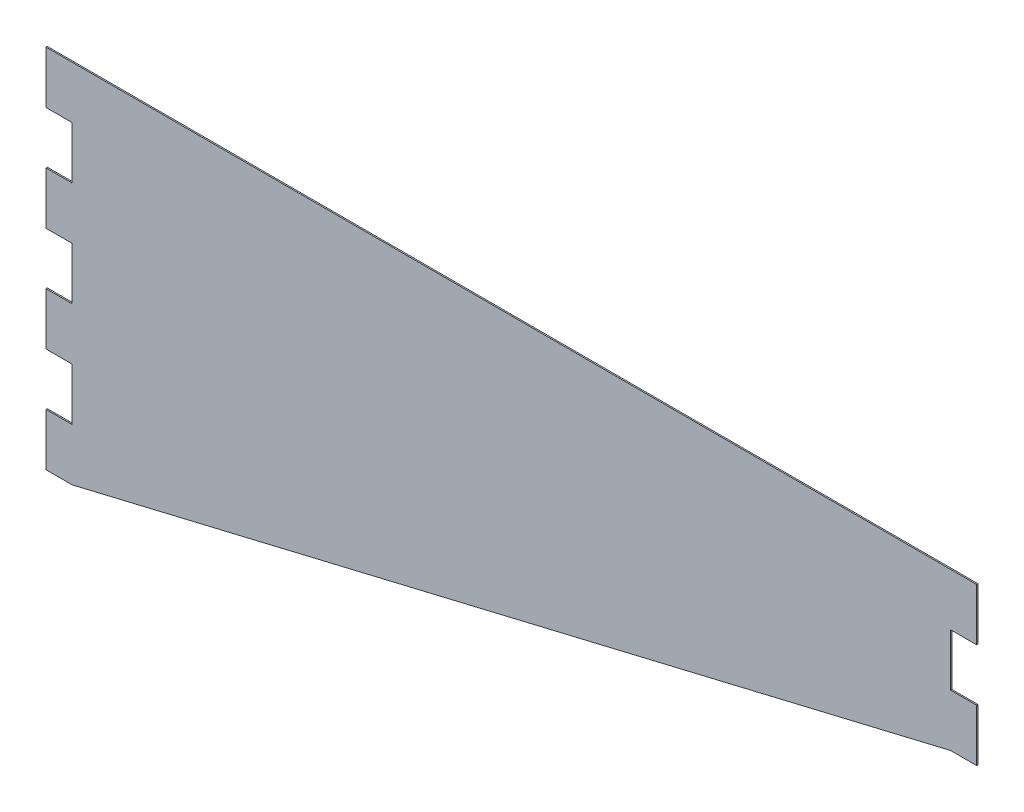
from build123d import *

# Parameters (mm, degrees)
BOSS_EXTRUDE1_DEPTH  = 0.125
SKETCH3_W            = 5
SKETCH3_H            = 10
CUT_EXTRUDE1_DEPTH   = 192.269606838
LPATTERN2_COUNT      = 4
LPATTERN2_PITCH      = 20
LPATTERN2_COUNT_DIR2 = 2
LPATTERN2_PITCH_DIR2 = 173


with BuildPart() as part:
    # Sketch2 → Boss-Extrude1 (new, symmetric)
    with BuildSketch(Plane.XY):
        Polygon((0, 0), (5, 0), (173, 40), (178, 40), (178, 70), (0, 70), align=None)
    extrude(amount=BOSS_EXTRUDE1_DEPTH, both=True)

    # Sketch3 → Cut-Extrude1 (cut, through all)
    with BuildSketch(Plane.XY.offset(0.125)):
        with Locations((2.5, 55)):
            Rectangle(SKETCH3_W, SKETCH3_H)
    cut_extrude1 = extrude(amount=-CUT_EXTRUDE1_DEPTH, mode=Mode.SUBTRACT)

    # LPattern2: Cut-Extrude1 4 × 2
    with Locations(*[(j * LPATTERN2_PITCH_DIR2, -i * LPATTERN2_PITCH, 0) for i in range(LPATTERN2_COUNT) for j in range(LPATTERN2_COUNT_DIR2) if (i, j) != (0, 0)]):
        add(cut_extrude1, mode=Mode.SUBTRACT)


solid = part.part
